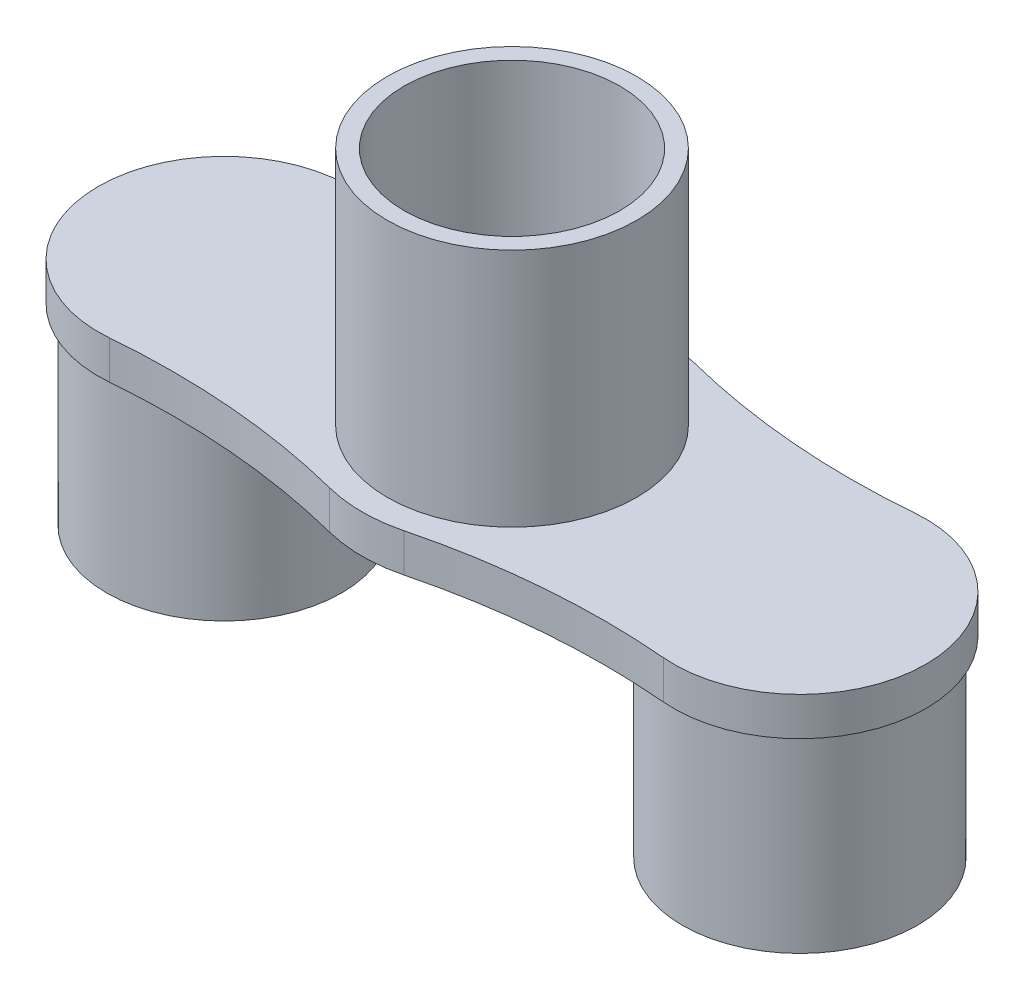
from build123d import *

# Parameters (mm, degrees)
BOSS_EXTRUDE1_DEPTH = 8
SKETCH2_R           = 26
SKETCH2_R_2         = 22.5
EXTRUDE_THIN1_DEPTH = 50
SKETCH3_R           = 24.5
SKETCH3_R_2         = 22.5
EXTRUDE_THIN2_DEPTH = 40


with BuildPart() as part:
    # Sketch1 → Boss-Extrude1 (new body)
    with BuildSketch(Plane(origin=(0, 0, 0), x_dir=(1, 0, 0), z_dir=(0, 1, 0))):
        with BuildLine():
            ThreePointArc((-7.74066092, -30.276140252), (0, -31.25), (7.74066092, -30.276140252))
            ThreePointArc((7.74066092, -30.276140252), (32.571933158, -26.108732409), (57.750443262, -26.153431792))
            ThreePointArc((57.750443262, -26.153431792), (86.25, 0), (57.750443262, 26.153431792))
            ThreePointArc((57.750443262, 26.153431792), (32.571933158, 26.108732409), (7.74066092, 30.276140252))
            ThreePointArc((7.74066092, 30.276140252), (0, 31.25), (-7.74066092, 30.276140252))
            ThreePointArc((-7.74066092, 30.276140252), (-32.571933158, 26.108732409), (-57.750443262, 26.153431792))
            ThreePointArc((-57.750443262, 26.153431792), (-86.25, 0), (-57.750443262, -26.153431792))
            ThreePointArc((-57.750443262, -26.153431792), (-32.571933158, -26.108732409), (-7.74066092, -30.276140252))
        make_face()
    extrude(amount=BOSS_EXTRUDE1_DEPTH)

    # Sketch2 → Extrude-Thin1 (add)
    with BuildSketch(Plane(origin=(0, 8, 0), x_dir=(1, 0, 0), z_dir=(0, 1, 0))):
        Circle(SKETCH2_R)
        Circle(SKETCH2_R_2, mode=Mode.SUBTRACT)
    extrude(amount=EXTRUDE_THIN1_DEPTH)

    # Sketch3 → Extrude-Thin2 (add)
    # profile 1 of 2: a face of its own
    with BuildSketch(Plane.XZ):
        with Locations((-60, 0)):
            Circle(SKETCH3_R)
        with Locations((-60, 0)):
            Circle(SKETCH3_R_2, mode=Mode.SUBTRACT)
    # profile 2 of 2: a face of its own
    with BuildSketch(Plane.XZ):
        with Locations((60, 0)):
            Circle(SKETCH3_R)
        with Locations((60, 0)):
            Circle(SKETCH3_R_2, mode=Mode.SUBTRACT)
    extrude(amount=EXTRUDE_THIN2_DEPTH)


solid = part.part
